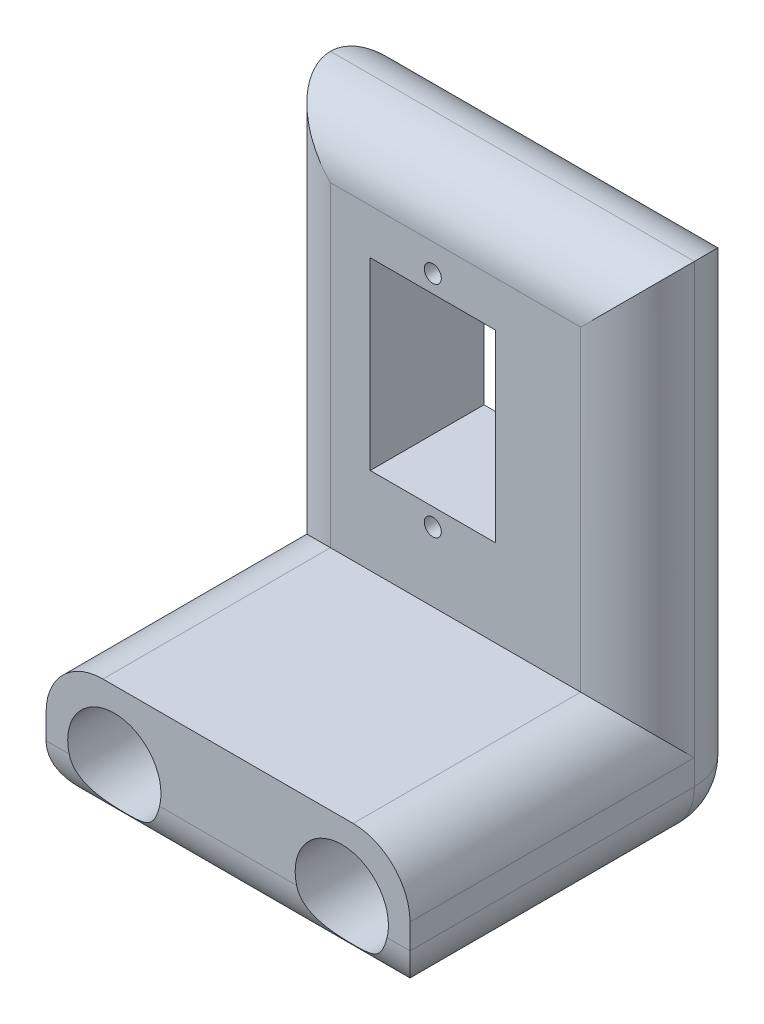
from build123d import *

# Parameters (mm, degrees)
SKETCH1_W           = 32
SKETCH1_H           = 45
BOSS_EXTRUDE1_DEPTH = 25
SKETCH2_R           = 4.1
CUT_EXTRUDE1_DEPTH  = 20
SKETCH3_W           = 32
SKETCH3_H           = 32.8
CUT_EXTRUDE2_DEPTH  = 20
SKETCH4_R           = 0.75
SKETCH4_W           = 11
SKETCH4_H           = 16.2
CUT_EXTRUDE3_DEPTH  = 57.400354609
SKETCH5_W           = 20
SKETCH5_H           = 45
CUT_EXTRUDE5_DEPTH  = 61.613529843
FILLET1_R           = 5


with BuildPart() as part:
    # Sketch1 → Boss-Extrude1 (new, symmetric)
    with BuildSketch(Plane.XY):
        with Locations((0, 22.5)):
            Rectangle(SKETCH1_W, SKETCH1_H)
    extrude(amount=BOSS_EXTRUDE1_DEPTH, both=True)

    # Sketch2 → Cut-Extrude1 (cut)
    with BuildSketch(Plane.XY.offset(25)):
        with Locations((10, 6)):
            Circle(SKETCH2_R)
        with Locations(Location((-10, 6, 0), (0, 0, 180))):
            Circle(SKETCH2_R)
    extrude(amount=-CUT_EXTRUDE1_DEPTH, mode=Mode.SUBTRACT)

    # Sketch3 → Cut-Extrude2 (cut)
    with BuildSketch(Plane.XY.offset(25)):
        with Locations((0, 28.6)):
            Rectangle(SKETCH3_W, SKETCH3_H)
    extrude(amount=-CUT_EXTRUDE2_DEPTH, mode=Mode.SUBTRACT)

    # Sketch4 → Cut-Extrude3 (cut, through all)
    with BuildSketch(Plane.XY.offset(5)):
        with Locations((-2, 37.58)):
            Circle(SKETCH4_R)
        with Locations((-2, 18.28)):
            Circle(SKETCH4_R)
        with Locations((-2, 27.93)):
            Rectangle(SKETCH4_W, SKETCH4_H)
    extrude(amount=-CUT_EXTRUDE3_DEPTH, mode=Mode.SUBTRACT)

    # Sketch5 → Cut-Extrude5 (cut, through all)
    with BuildSketch(Plane.ZY.offset(16)):
        with Locations((-15, 22.5)):
            Rectangle(SKETCH5_W, SKETCH5_H)
    extrude(amount=-CUT_EXTRUDE5_DEPTH, mode=Mode.SUBTRACT)

    # Fillet1
    # the kernel refuses this fillet: 5 mm, written as the material it takes off along each edge
    with BuildSketch(Plane(origin=(-11, 5, 0), x_dir=(-1, 0, 0), z_dir=(0, -1, 0))) as fillet1_piece_1_section:
        Polygon((0, 0), (FILLET1_R * 1.02, 0), (FILLET1_R * 1.02, FILLET1_R * 1.02), (0, FILLET1_R * 1.02), align=None)
    fillet1_piece_1 = extrude(amount=FILLET1_R * 1.02, mode=Mode.PRIVATE)
    fillet1_piece_1 = fillet1_piece_1 - Plane(origin=(-11, 5, 0), x_dir=(0.7071067811865475, 0, 0.7071067811865475), z_dir=(0, -1, 0)) * Sphere(FILLET1_R, mode=Mode.PRIVATE)
    add(fillet1_piece_1, mode=Mode.SUBTRACT)
    with BuildSketch(Plane(origin=(11, 5, 0), x_dir=(1, 0, 0), z_dir=(0, -1, 0))) as fillet1_piece_2_section:
        Polygon((0, 0), (FILLET1_R * 1.02, 0), (FILLET1_R * 1.02, -FILLET1_R * 1.02), (0, -FILLET1_R * 1.02), align=None)
    fillet1_piece_2 = extrude(amount=FILLET1_R * 1.02, mode=Mode.PRIVATE)
    fillet1_piece_2 = fillet1_piece_2 - Plane(origin=(11, 5, 0), x_dir=(-0.7071067811865475, 0, 0.7071067811865475), z_dir=(0, -1, 0)) * Sphere(FILLET1_R, mode=Mode.PRIVATE)
    add(fillet1_piece_2, mode=Mode.SUBTRACT)
    with BuildSketch(Plane(origin=(16, 12.2, 25), x_dir=(0, -1, 0), z_dir=(0, 0, -1))) as fillet1_piece_3:
        with BuildLine():
            CenterArc((FILLET1_R, FILLET1_R), FILLET1_R, 180, 90)
            Line((0, FILLET1_R), (-FILLET1_R * 0.02, FILLET1_R))
            Line((-FILLET1_R * 0.02, FILLET1_R), (-FILLET1_R * 0.02, -FILLET1_R * 0.02))
            Line((-FILLET1_R * 0.02, -FILLET1_R * 0.02), (FILLET1_R, -FILLET1_R * 0.02))
            Line((FILLET1_R, -FILLET1_R * 0.02), (FILLET1_R, 0))
        make_face()
    extrude(amount=20, mode=Mode.SUBTRACT)
    with BuildSketch(Plane(origin=(-11, 0, -5), x_dir=(0, 0, 1), z_dir=(1, 0, 0))) as fillet1_piece_4:
        with BuildLine():
            CenterArc((FILLET1_R, -FILLET1_R), FILLET1_R, 90, 90)
            Line((0, -FILLET1_R), (-FILLET1_R * 0.02, -FILLET1_R))
            Line((-FILLET1_R * 0.02, -FILLET1_R), (-FILLET1_R * 0.02, FILLET1_R * 0.02))
            Line((-FILLET1_R * 0.02, FILLET1_R * 0.02), (FILLET1_R, FILLET1_R * 0.02))
            Line((FILLET1_R, FILLET1_R * 0.02), (FILLET1_R, 0))
        make_face()
    extrude(amount=22, mode=Mode.SUBTRACT)
    with BuildSketch(Plane(origin=(-16, 45, -5), x_dir=(0, -1, 0), z_dir=(1, 0, 0)), Plane(origin=(16, 45, 5), x_dir=(0, -1, 0), z_dir=(-1, 0, 0))) as fillet1_piece_5:
        with BuildLine():
            CenterArc((FILLET1_R, -FILLET1_R), FILLET1_R, 90, 90)
            Line((0, -FILLET1_R), (-FILLET1_R * 0.02, -FILLET1_R))
            Line((-FILLET1_R * 0.02, -FILLET1_R), (-FILLET1_R * 0.02, FILLET1_R * 0.02))
            Line((-FILLET1_R * 0.02, FILLET1_R * 0.02), (FILLET1_R, FILLET1_R * 0.02))
            Line((FILLET1_R, FILLET1_R * 0.02), (FILLET1_R, 0))
        make_face()
    extrude(amount=32, mode=Mode.SUBTRACT)
    with BuildSketch(Plane(origin=(-16, 45, -5), x_dir=(0, 0, 1), z_dir=(0, -1, 0)), Plane(origin=(16, 5, -5), x_dir=(0, 0, 1), z_dir=(0, 1, 0))) as fillet1_piece_6:
        with BuildLine():
            CenterArc((FILLET1_R, -FILLET1_R), FILLET1_R, 90, 90)
            Line((0, -FILLET1_R), (-FILLET1_R * 0.02, -FILLET1_R))
            Line((-FILLET1_R * 0.02, -FILLET1_R), (-FILLET1_R * 0.02, FILLET1_R * 0.02))
            Line((-FILLET1_R * 0.02, FILLET1_R * 0.02), (FILLET1_R, FILLET1_R * 0.02))
            Line((FILLET1_R, FILLET1_R * 0.02), (FILLET1_R, 0))
        make_face()
    extrude(amount=40, mode=Mode.SUBTRACT)
    with BuildSketch(Plane(origin=(16, 0, 0), x_dir=(-1, 0, 0), z_dir=(0, 0, 1)), Plane(origin=(-16, 0, 25), x_dir=(1, 0, 0), z_dir=(0, 0, -1))) as fillet1_piece_7:
        with BuildLine():
            CenterArc((FILLET1_R, -FILLET1_R), FILLET1_R, 90, 90)
            Line((0, -FILLET1_R), (-FILLET1_R * 0.02, -FILLET1_R))
            Line((-FILLET1_R * 0.02, -FILLET1_R), (-FILLET1_R * 0.02, FILLET1_R * 0.02))
            Line((-FILLET1_R * 0.02, FILLET1_R * 0.02), (FILLET1_R, FILLET1_R * 0.02))
            Line((FILLET1_R, FILLET1_R * 0.02), (FILLET1_R, 0))
        make_face()
    extrude(amount=25, mode=Mode.SUBTRACT)
    with BuildSketch(Plane(origin=(-16, 0, 25), x_dir=(0, 0, -1), z_dir=(1, 0, 0))) as fillet1_piece_8:
        with BuildLine():
            CenterArc((FILLET1_R, FILLET1_R), FILLET1_R, 180, 90)
            Line((0, FILLET1_R), (-FILLET1_R * 0.02, FILLET1_R))
            Line((-FILLET1_R * 0.02, FILLET1_R), (-FILLET1_R * 0.02, -FILLET1_R * 0.02))
            Line((-FILLET1_R * 0.02, -FILLET1_R * 0.02), (FILLET1_R, -FILLET1_R * 0.02))
            Line((FILLET1_R, -FILLET1_R * 0.02), (FILLET1_R, 0))
        make_face()
    extrude(amount=32, mode=Mode.SUBTRACT)
    with BuildSketch(Plane(origin=(-16, 12.2, 25), x_dir=(0, -1, 0), z_dir=(0, 0, -1))) as fillet1_piece_9:
        with BuildLine():
            CenterArc((FILLET1_R, -FILLET1_R), FILLET1_R, 90, 90)
            Line((0, -FILLET1_R), (-FILLET1_R * 0.02, -FILLET1_R))
            Line((-FILLET1_R * 0.02, -FILLET1_R), (-FILLET1_R * 0.02, FILLET1_R * 0.02))
            Line((-FILLET1_R * 0.02, FILLET1_R * 0.02), (FILLET1_R, FILLET1_R * 0.02))
            Line((FILLET1_R, FILLET1_R * 0.02), (FILLET1_R, 0))
        make_face()
    extrude(amount=20, mode=Mode.SUBTRACT)
    with BuildSketch(Plane(origin=(16, 12.2, 5), x_dir=(0, 0, -1), z_dir=(0, 1, 0)), Plane(origin=(-16, 45, 5), x_dir=(0, 0, -1), z_dir=(0, -1, 0))) as fillet1_piece_10:
        with BuildLine():
            CenterArc((FILLET1_R, FILLET1_R), FILLET1_R, 180, 90)
            Line((0, FILLET1_R), (-FILLET1_R * 0.02, FILLET1_R))
            Line((-FILLET1_R * 0.02, FILLET1_R), (-FILLET1_R * 0.02, -FILLET1_R * 0.02))
            Line((-FILLET1_R * 0.02, -FILLET1_R * 0.02), (FILLET1_R, -FILLET1_R * 0.02))
            Line((FILLET1_R, -FILLET1_R * 0.02), (FILLET1_R, 0))
        make_face()
    extrude(amount=32.8, mode=Mode.SUBTRACT)
    with BuildSketch(Plane(origin=(16, 12.2, 25), x_dir=(0, -1, 0), z_dir=(0, 0, -1))) as fillet1_piece_11a_section:
        with BuildLine():
            CenterArc((FILLET1_R, FILLET1_R), FILLET1_R, 180, 90)
            Line((0, FILLET1_R), (-FILLET1_R * 0.02, FILLET1_R))
            Line((-FILLET1_R * 0.02, FILLET1_R), (-FILLET1_R * 0.02, -FILLET1_R * 0.02))
            Line((-FILLET1_R * 0.02, -FILLET1_R * 0.02), (FILLET1_R, -FILLET1_R * 0.02))
            Line((FILLET1_R, -FILLET1_R * 0.02), (FILLET1_R, 0))
        make_face()
    fillet1_piece_11a = extrude(amount=32.5, mode=Mode.PRIVATE)
    fillet1_piece_11a = split(fillet1_piece_11a, bisect_by=Plane(origin=(14.868024429, 11.068024429, 5), z_dir=(0, 0, -1)), keep=Keep.TOP, mode=Mode.PRIVATE)
    with BuildSketch(Plane(origin=(16, -0.3, 5), x_dir=(0, 0, -1), z_dir=(0, 1, 0))) as fillet1_piece_11b_section:
        with BuildLine():
            CenterArc((FILLET1_R, FILLET1_R), FILLET1_R, 180, 90)
            Line((0, FILLET1_R), (-FILLET1_R * 0.02, FILLET1_R))
            Line((-FILLET1_R * 0.02, FILLET1_R), (-FILLET1_R * 0.02, -FILLET1_R * 0.02))
            Line((-FILLET1_R * 0.02, -FILLET1_R * 0.02), (FILLET1_R, -FILLET1_R * 0.02))
            Line((FILLET1_R, -FILLET1_R * 0.02), (FILLET1_R, 0))
        make_face()
    fillet1_piece_11b = extrude(amount=45.3, mode=Mode.PRIVATE)
    fillet1_piece_11b = split(fillet1_piece_11b, bisect_by=Plane(origin=(14.868024429, 12.2, 3.868024429), z_dir=(0, -1, 0)), keep=Keep.TOP, mode=Mode.PRIVATE)
    fillet1_piece_11 = fillet1_piece_11a & fillet1_piece_11b
    add(fillet1_piece_11, mode=Mode.SUBTRACT)
    with BuildSketch(Plane(origin=(-16, 57.5, -5), x_dir=(0, 0, 1), z_dir=(0, -1, 0))) as fillet1_piece_12a_section:
        with BuildLine():
            CenterArc((FILLET1_R, -FILLET1_R), FILLET1_R, 90, 90)
            Line((0, -FILLET1_R), (-FILLET1_R * 0.02, -FILLET1_R))
            Line((-FILLET1_R * 0.02, -FILLET1_R), (-FILLET1_R * 0.02, FILLET1_R * 0.02))
            Line((-FILLET1_R * 0.02, FILLET1_R * 0.02), (FILLET1_R, FILLET1_R * 0.02))
            Line((FILLET1_R, FILLET1_R * 0.02), (FILLET1_R, 0))
        make_face()
    fillet1_piece_12a = extrude(amount=52.5, mode=Mode.PRIVATE)
    fillet1_piece_12a = split(fillet1_piece_12a, bisect_by=Plane(origin=(-14.868024429, 45, -3.868024429), z_dir=(0, 1, 0)), keep=Keep.TOP, mode=Mode.PRIVATE)
    with BuildSketch(Plane(origin=(-28.5, 45, -5), x_dir=(0, -1, 0), z_dir=(1, 0, 0))) as fillet1_piece_12b_section:
        with BuildLine():
            CenterArc((FILLET1_R, -FILLET1_R), FILLET1_R, 90, 90)
            Line((0, -FILLET1_R), (-FILLET1_R * 0.02, -FILLET1_R))
            Line((-FILLET1_R * 0.02, -FILLET1_R), (-FILLET1_R * 0.02, FILLET1_R * 0.02))
            Line((-FILLET1_R * 0.02, FILLET1_R * 0.02), (FILLET1_R, FILLET1_R * 0.02))
            Line((FILLET1_R, FILLET1_R * 0.02), (FILLET1_R, 0))
        make_face()
    fillet1_piece_12b = extrude(amount=44.5, mode=Mode.PRIVATE)
    fillet1_piece_12b = split(fillet1_piece_12b, bisect_by=Plane(origin=(-16, 43.868024429, -3.868024429), z_dir=(-1, 0, 0)), keep=Keep.TOP, mode=Mode.PRIVATE)
    fillet1_piece_12 = fillet1_piece_12a & fillet1_piece_12b
    add(fillet1_piece_12, mode=Mode.SUBTRACT)
    with BuildSketch(Plane(origin=(16, 5, -5), x_dir=(0, 0, 1), z_dir=(0, 1, 0))) as fillet1_piece_13a_section:
        with BuildLine():
            CenterArc((FILLET1_R, -FILLET1_R), FILLET1_R, 90, 90)
            Line((0, -FILLET1_R), (-FILLET1_R * 0.02, -FILLET1_R))
            Line((-FILLET1_R * 0.02, -FILLET1_R), (-FILLET1_R * 0.02, FILLET1_R * 0.02))
            Line((-FILLET1_R * 0.02, FILLET1_R * 0.02), (FILLET1_R, FILLET1_R * 0.02))
            Line((FILLET1_R, FILLET1_R * 0.02), (FILLET1_R, 0))
        make_face()
    fillet1_piece_13a = extrude(amount=52.5, mode=Mode.PRIVATE)
    fillet1_piece_13a = split(fillet1_piece_13a, bisect_by=Plane(origin=(14.868024429, 45, -3.868024429), z_dir=(0, 1, 0)), keep=Keep.TOP, mode=Mode.PRIVATE)
    with BuildSketch(Plane(origin=(-16, 45, -5), x_dir=(0, -1, 0), z_dir=(1, 0, 0))) as fillet1_piece_13b_section:
        with BuildLine():
            CenterArc((FILLET1_R, -FILLET1_R), FILLET1_R, 90, 90)
            Line((0, -FILLET1_R), (-FILLET1_R * 0.02, -FILLET1_R))
            Line((-FILLET1_R * 0.02, -FILLET1_R), (-FILLET1_R * 0.02, FILLET1_R * 0.02))
            Line((-FILLET1_R * 0.02, FILLET1_R * 0.02), (FILLET1_R, FILLET1_R * 0.02))
            Line((FILLET1_R, FILLET1_R * 0.02), (FILLET1_R, 0))
        make_face()
    fillet1_piece_13b = extrude(amount=44.5, mode=Mode.PRIVATE)
    fillet1_piece_13b = split(fillet1_piece_13b, bisect_by=Plane(origin=(16, 43.868024429, -3.868024429), z_dir=(1, 0, 0)), keep=Keep.TOP, mode=Mode.PRIVATE)
    fillet1_piece_13 = fillet1_piece_13a & fillet1_piece_13b
    add(fillet1_piece_13, mode=Mode.SUBTRACT)
    with BuildSketch(Plane(origin=(-16, 0, 25), x_dir=(0, 0, -1), z_dir=(1, 0, 0))) as fillet1_piece_14a_section:
        with BuildLine():
            CenterArc((FILLET1_R, FILLET1_R), FILLET1_R, 180, 90)
            Line((0, FILLET1_R), (-FILLET1_R * 0.02, FILLET1_R))
            Line((-FILLET1_R * 0.02, FILLET1_R), (-FILLET1_R * 0.02, -FILLET1_R * 0.02))
            Line((-FILLET1_R * 0.02, -FILLET1_R * 0.02), (FILLET1_R, -FILLET1_R * 0.02))
            Line((FILLET1_R, -FILLET1_R * 0.02), (FILLET1_R, 0))
        make_face()
    fillet1_piece_14a = extrude(amount=44.5, mode=Mode.PRIVATE)
    fillet1_piece_14a = split(fillet1_piece_14a, bisect_by=Plane(origin=(16, 1.131975571, 23.868024429), z_dir=(1, 0, 0)), keep=Keep.TOP, mode=Mode.PRIVATE)
    with BuildSketch(Plane(origin=(16, 0, 0), x_dir=(-1, 0, 0), z_dir=(0, 0, 1))) as fillet1_piece_14b_section:
        with BuildLine():
            CenterArc((FILLET1_R, -FILLET1_R), FILLET1_R, 90, 90)
            Line((0, -FILLET1_R), (-FILLET1_R * 0.02, -FILLET1_R))
            Line((-FILLET1_R * 0.02, -FILLET1_R), (-FILLET1_R * 0.02, FILLET1_R * 0.02))
            Line((-FILLET1_R * 0.02, FILLET1_R * 0.02), (FILLET1_R, FILLET1_R * 0.02))
            Line((FILLET1_R, FILLET1_R * 0.02), (FILLET1_R, 0))
        make_face()
    fillet1_piece_14b = extrude(amount=37.5, mode=Mode.PRIVATE)
    fillet1_piece_14b = split(fillet1_piece_14b, bisect_by=Plane(origin=(14.868024429, 1.131975571, 25), z_dir=(0, 0, 1)), keep=Keep.TOP, mode=Mode.PRIVATE)
    fillet1_piece_14 = fillet1_piece_14a & fillet1_piece_14b
    add(fillet1_piece_14, mode=Mode.SUBTRACT)
    with BuildSketch(Plane(origin=(-16, 0, 37.5), x_dir=(1, 0, 0), z_dir=(0, 0, -1))) as fillet1_piece_15a_section:
        with BuildLine():
            CenterArc((FILLET1_R, -FILLET1_R), FILLET1_R, 90, 90)
            Line((0, -FILLET1_R), (-FILLET1_R * 0.02, -FILLET1_R))
            Line((-FILLET1_R * 0.02, -FILLET1_R), (-FILLET1_R * 0.02, FILLET1_R * 0.02))
            Line((-FILLET1_R * 0.02, FILLET1_R * 0.02), (FILLET1_R, FILLET1_R * 0.02))
            Line((FILLET1_R, FILLET1_R * 0.02), (FILLET1_R, 0))
        make_face()
    fillet1_piece_15a = extrude(amount=37.5, mode=Mode.PRIVATE)
    fillet1_piece_15a = split(fillet1_piece_15a, bisect_by=Plane(origin=(-14.868024429, 1.131975571, 25), z_dir=(0, 0, 1)), keep=Keep.TOP, mode=Mode.PRIVATE)
    with BuildSketch(Plane(origin=(-28.5, 0, 25), x_dir=(0, 0, -1), z_dir=(1, 0, 0))) as fillet1_piece_15b_section:
        with BuildLine():
            CenterArc((FILLET1_R, FILLET1_R), FILLET1_R, 180, 90)
            Line((0, FILLET1_R), (-FILLET1_R * 0.02, FILLET1_R))
            Line((-FILLET1_R * 0.02, FILLET1_R), (-FILLET1_R * 0.02, -FILLET1_R * 0.02))
            Line((-FILLET1_R * 0.02, -FILLET1_R * 0.02), (FILLET1_R, -FILLET1_R * 0.02))
            Line((FILLET1_R, -FILLET1_R * 0.02), (FILLET1_R, 0))
        make_face()
    fillet1_piece_15b = extrude(amount=44.5, mode=Mode.PRIVATE)
    fillet1_piece_15b = split(fillet1_piece_15b, bisect_by=Plane(origin=(-16, 1.131975571, 23.868024429), z_dir=(-1, 0, 0)), keep=Keep.TOP, mode=Mode.PRIVATE)
    fillet1_piece_15 = fillet1_piece_15a & fillet1_piece_15b
    add(fillet1_piece_15, mode=Mode.SUBTRACT)
    with BuildSketch(Plane(origin=(-16, 45, 5), x_dir=(0, 0, -1), z_dir=(0, -1, 0))) as fillet1_piece_16a_section:
        with BuildLine():
            CenterArc((FILLET1_R, FILLET1_R), FILLET1_R, 180, 90)
            Line((0, FILLET1_R), (-FILLET1_R * 0.02, FILLET1_R))
            Line((-FILLET1_R * 0.02, FILLET1_R), (-FILLET1_R * 0.02, -FILLET1_R * 0.02))
            Line((-FILLET1_R * 0.02, -FILLET1_R * 0.02), (FILLET1_R, -FILLET1_R * 0.02))
            Line((FILLET1_R, -FILLET1_R * 0.02), (FILLET1_R, 0))
        make_face()
    fillet1_piece_16a = extrude(amount=45.3, mode=Mode.PRIVATE)
    fillet1_piece_16a = split(fillet1_piece_16a, bisect_by=Plane(origin=(-14.868024429, 12.2, 3.868024429), z_dir=(0, -1, 0)), keep=Keep.TOP, mode=Mode.PRIVATE)
    with BuildSketch(Plane(origin=(-16, 12.2, 25), x_dir=(0, -1, 0), z_dir=(0, 0, -1))) as fillet1_piece_16b_section:
        with BuildLine():
            CenterArc((FILLET1_R, -FILLET1_R), FILLET1_R, 90, 90)
            Line((0, -FILLET1_R), (-FILLET1_R * 0.02, -FILLET1_R))
            Line((-FILLET1_R * 0.02, -FILLET1_R), (-FILLET1_R * 0.02, FILLET1_R * 0.02))
            Line((-FILLET1_R * 0.02, FILLET1_R * 0.02), (FILLET1_R, FILLET1_R * 0.02))
            Line((FILLET1_R, FILLET1_R * 0.02), (FILLET1_R, 0))
        make_face()
    fillet1_piece_16b = extrude(amount=32.5, mode=Mode.PRIVATE)
    fillet1_piece_16b = split(fillet1_piece_16b, bisect_by=Plane(origin=(-14.868024429, 11.068024429, 5), z_dir=(0, 0, -1)), keep=Keep.TOP, mode=Mode.PRIVATE)
    fillet1_piece_16 = fillet1_piece_16a & fillet1_piece_16b
    add(fillet1_piece_16, mode=Mode.SUBTRACT)
    with BuildSketch(Plane(origin=(16, 12.2, 5), x_dir=(0, 0, -1), z_dir=(0, 1, 0))) as fillet1_piece_17a_section:
        with BuildLine():
            CenterArc((FILLET1_R, FILLET1_R), FILLET1_R, 180, 90)
            Line((0, FILLET1_R), (-FILLET1_R * 0.02, FILLET1_R))
            Line((-FILLET1_R * 0.02, FILLET1_R), (-FILLET1_R * 0.02, -FILLET1_R * 0.02))
            Line((-FILLET1_R * 0.02, -FILLET1_R * 0.02), (FILLET1_R, -FILLET1_R * 0.02))
            Line((FILLET1_R, -FILLET1_R * 0.02), (FILLET1_R, 0))
        make_face()
    fillet1_piece_17a = extrude(amount=45.3, mode=Mode.PRIVATE)
    fillet1_piece_17a = split(fillet1_piece_17a, bisect_by=Plane(origin=(14.868024429, 45, 3.868024429), z_dir=(0, 1, 0)), keep=Keep.TOP, mode=Mode.PRIVATE)
    with BuildSketch(Plane(origin=(28.5, 45, 5), x_dir=(0, -1, 0), z_dir=(-1, 0, 0))) as fillet1_piece_17b_section:
        with BuildLine():
            CenterArc((FILLET1_R, -FILLET1_R), FILLET1_R, 90, 90)
            Line((0, -FILLET1_R), (-FILLET1_R * 0.02, -FILLET1_R))
            Line((-FILLET1_R * 0.02, -FILLET1_R), (-FILLET1_R * 0.02, FILLET1_R * 0.02))
            Line((-FILLET1_R * 0.02, FILLET1_R * 0.02), (FILLET1_R, FILLET1_R * 0.02))
            Line((FILLET1_R, FILLET1_R * 0.02), (FILLET1_R, 0))
        make_face()
    fillet1_piece_17b = extrude(amount=44.5, mode=Mode.PRIVATE)
    fillet1_piece_17b = split(fillet1_piece_17b, bisect_by=Plane(origin=(16, 43.868024429, 3.868024429), z_dir=(1, 0, 0)), keep=Keep.TOP, mode=Mode.PRIVATE)
    fillet1_piece_17 = fillet1_piece_17a & fillet1_piece_17b
    add(fillet1_piece_17, mode=Mode.SUBTRACT)
    with BuildSketch(Plane(origin=(-16, 57.5, 5), x_dir=(0, 0, -1), z_dir=(0, -1, 0))) as fillet1_piece_18a_section:
        with BuildLine():
            CenterArc((FILLET1_R, FILLET1_R), FILLET1_R, 180, 90)
            Line((0, FILLET1_R), (-FILLET1_R * 0.02, FILLET1_R))
            Line((-FILLET1_R * 0.02, FILLET1_R), (-FILLET1_R * 0.02, -FILLET1_R * 0.02))
            Line((-FILLET1_R * 0.02, -FILLET1_R * 0.02), (FILLET1_R, -FILLET1_R * 0.02))
            Line((FILLET1_R, -FILLET1_R * 0.02), (FILLET1_R, 0))
        make_face()
    fillet1_piece_18a = extrude(amount=45.3, mode=Mode.PRIVATE)
    fillet1_piece_18a = split(fillet1_piece_18a, bisect_by=Plane(origin=(-14.868024429, 45, 3.868024429), z_dir=(0, 1, 0)), keep=Keep.TOP, mode=Mode.PRIVATE)
    with BuildSketch(Plane(origin=(16, 45, 5), x_dir=(0, -1, 0), z_dir=(-1, 0, 0))) as fillet1_piece_18b_section:
        with BuildLine():
            CenterArc((FILLET1_R, -FILLET1_R), FILLET1_R, 90, 90)
            Line((0, -FILLET1_R), (-FILLET1_R * 0.02, -FILLET1_R))
            Line((-FILLET1_R * 0.02, -FILLET1_R), (-FILLET1_R * 0.02, FILLET1_R * 0.02))
            Line((-FILLET1_R * 0.02, FILLET1_R * 0.02), (FILLET1_R, FILLET1_R * 0.02))
            Line((FILLET1_R, FILLET1_R * 0.02), (FILLET1_R, 0))
        make_face()
    fillet1_piece_18b = extrude(amount=44.5, mode=Mode.PRIVATE)
    fillet1_piece_18b = split(fillet1_piece_18b, bisect_by=Plane(origin=(-16, 43.868024429, 3.868024429), z_dir=(-1, 0, 0)), keep=Keep.TOP, mode=Mode.PRIVATE)
    fillet1_piece_18 = fillet1_piece_18a & fillet1_piece_18b
    add(fillet1_piece_18, mode=Mode.SUBTRACT)


solid = part.part
